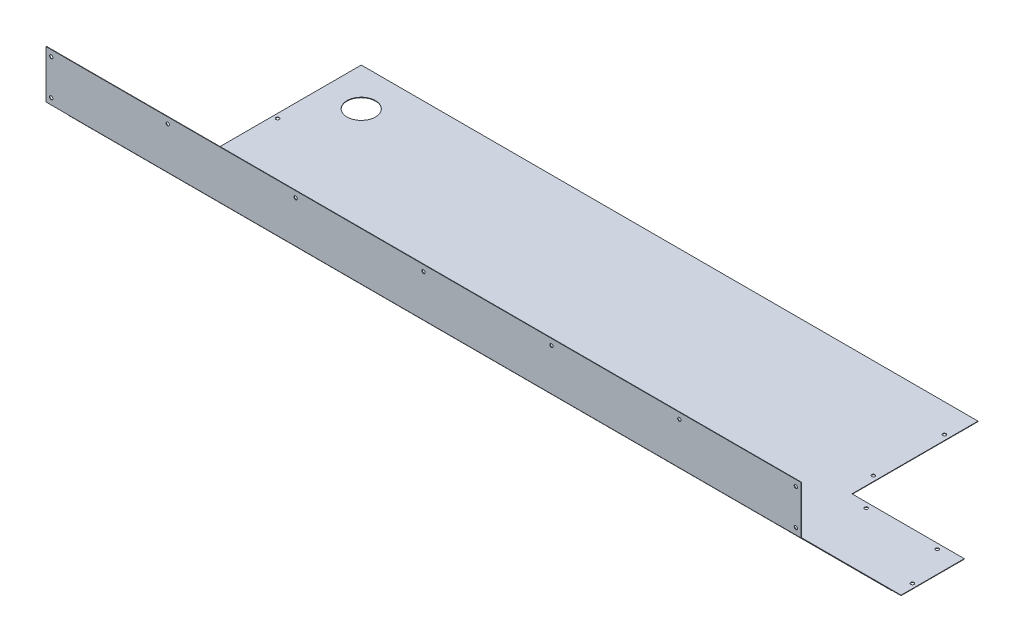
from build123d import *

# Parameters (mm, degrees)
SM_BASE_FLANGE_1_DEPTH = 797
SKETCH_3_W             = 240.030004828
SKETCH_3_H             = 245.89814066
CUT_EXTRUDE_1_DEPTH    = 46
SKETCH_4_W             = 434.416474362
SKETCH_4_H             = 72.764759455
CUT_EXTRUDE_2_DEPTH    = 27.5
SKETCH_6_W             = 323.282059801
SKETCH_6_H             = 316.328682171
CUT_EXTRUDE_3_DEPTH    = 1076.72022385
SKETCH_7_R             = 3.5
CUT_EXTRUDE_4_DEPTH    = 1076.443164468
SKETCH_8_R             = 3.5
CUT_EXTRUDE_5_DEPTH    = 1076.72022385
SKETCH_10_R            = 3.5
CUT_EXTRUDE_6_DEPTH    = 976.892146686
SKETCH_11_R            = 3.5
CUT_EXTRUDE_7_DEPTH    = 977.427672693
SKETCH_12_R            = 30
CUT_EXTRUDE_8_DEPTH    = 1076.72022385


# Sheet-metal steps are written as plain solids
with BuildPart() as part:
    # Sketch 1 → 基体-法兰1 (new, symmetric)
    with BuildSketch(Plane(origin=(0, 0, 0), x_dir=(0, 0, -1), z_dir=(1, 0, 0))):
        with BuildLine():
            Line((0, 340), (0, 238.621320344))
            ThreePointArc((0, 238.621320344), (0.114180701, 238.047295195), (0.439339828, 237.560660172))
            Line((0.439339828, 237.560660172), (237.560660172, 0.439339828))
            ThreePointArc((237.560660172, 0.439339828), (238.047295195, 0.114180701), (238.621320344, 0))
            Line((238.621320344, 0), (638, 0))
            Line((638, 0), (638, 1))
            Line((638, 1), (238.621320344, 1))
            ThreePointArc((238.621320344, 1), (238.429978627, 1.038060234), (238.267766953, 1.146446609))
            Line((238.267766953, 1.146446609), (1.146446609, 238.267766953))
            ThreePointArc((1.146446609, 238.267766953), (1.038060234, 238.429978627), (1, 238.621320344))
            Line((1, 238.621320344), (1, 340))
            Line((1, 340), (0, 340))
        make_face()
    extrude(amount=SM_BASE_FLANGE_1_DEPTH, both=True)

    # 草图3 → 切除-拉伸1 (cut)
    with BuildSketch(Plane(origin=(797, 0, 0), x_dir=(0, 0, -1), z_dir=(1, 0, 0))):
        with Locations((118.60631793, 115.672250014)):
            Rectangle(SKETCH_3_W, SKETCH_3_H)
    cut_extrude_1 = extrude(amount=-CUT_EXTRUDE_1_DEPTH, mode=Mode.SUBTRACT)

    # 草图4 → 切除-拉伸2 (cut)
    with BuildSketch(Plane(origin=(797, 0, 0), x_dir=(0, 0, -1), z_dir=(1, 0, 0))):
        with Locations((445.827818623, 0.227200405)):
            Rectangle(SKETCH_4_W, SKETCH_4_H)
    cut_extrude_2 = extrude(amount=-CUT_EXTRUDE_2_DEPTH, mode=Mode.SUBTRACT)

    # 镜向2: 切除-拉伸1, 切除-拉伸2 across plane
    add(cut_extrude_1.mirror(Plane(origin=(0, 0, 0), x_dir=(0, 0, 1), z_dir=(1, 0, 0))), mode=Mode.SUBTRACT)
    add(cut_extrude_2.mirror(Plane(origin=(0, 0, 0), x_dir=(0, 0, 1), z_dir=(1, 0, 0))), mode=Mode.SUBTRACT)

    # 草图6 → 切除-拉伸3 (cut, through all)
    with BuildSketch(Plane(origin=(0, 1, 0), x_dir=(1, 0, 0), z_dir=(0, 1, 0))):
        with Locations((694.141029901, 530.164341086)):
            Rectangle(SKETCH_6_W, SKETCH_6_H)
    extrude(amount=-CUT_EXTRUDE_3_DEPTH, mode=Mode.SUBTRACT)

    # 草图7 → 切除-拉伸4 (cut, through all)
    with BuildSketch(Plane(origin=(0, 0, -1), x_dir=(-1, 0, 0), z_dir=(0, 0, -1))):
        with Locations(Location((0, 327, 0), (0, 0, 90))):
            Circle(SKETCH_7_R)
        with Locations(Location((270, 327, 0), (0, 0, 90))):
            Circle(SKETCH_7_R)
        with Locations(Location((540, 327, 0), (0, 0, 90))):
            Circle(SKETCH_7_R)
        with Locations(Location((786, 327, 0), (0, 0, 90))):
            Circle(SKETCH_7_R)
        with Locations(Location((786, 252, 0), (0, 0, 90))):
            Circle(SKETCH_7_R)
        with Locations(Location((-270, 327, 0), (0, 0, 90))):
            Circle(SKETCH_7_R)
        with Locations(Location((-540, 327, 0), (0, 0, 90))):
            Circle(SKETCH_7_R)
        with Locations(Location((-786, 327, 0), (0, 0, 90))):
            Circle(SKETCH_7_R)
        with Locations(Location((-786, 252, 0), (0, 0, 90))):
            Circle(SKETCH_7_R)
    extrude(amount=-CUT_EXTRUDE_4_DEPTH, mode=Mode.SUBTRACT)

    # 草图8 → 切除-拉伸5 (cut, through all)
    with BuildSketch(Plane(origin=(0, 1, 0), x_dir=(1, 0, 0), z_dir=(0, 1, 0))):
        with Locations(Location((-760, 452, 0), (0, 0, 270))):
            Circle(SKETCH_8_R)
        with Locations(Location((-760, 272, 0), (0, 0, 270))):
            Circle(SKETCH_8_R)
        with Locations(Location((521.5, 578, 0), (0, 0, 270))):
            Circle(SKETCH_8_R)
        with Locations(Location((521.5, 428, 0), (0, 0, 270))):
            Circle(SKETCH_8_R)
        with Locations(Location((573.5, 361, 0), (0, 0, 270))):
            Circle(SKETCH_8_R)
        with Locations(Location((723.5, 361, 0), (0, 0, 270))):
            Circle(SKETCH_8_R)
        with Locations(Location((760, 272, 0), (0, 0, 270))):
            Circle(SKETCH_8_R)
    extrude(amount=-CUT_EXTRUDE_5_DEPTH, mode=Mode.SUBTRACT)

    # 草图10 → 切除-拉伸6 (cut, through all)
    with BuildSketch(Plane(origin=(0, 119.707106781, -119.707106781), x_dir=(1, 0, 0), z_dir=(0, 0.7071067811865477, -0.7071067811865475))):
        with Locations(Location((740, 2.995728589, 0), (0, 0, 270))):
            Circle(SKETCH_10_R)
        with Locations(Location((740, -142.004271411, 0), (0, 0, 270))):
            Circle(SKETCH_10_R)
        with Locations(Location((740, 147.995728589, 0), (0, 0, 270))):
            Circle(SKETCH_10_R)
    extrude(amount=-CUT_EXTRUDE_6_DEPTH, mode=Mode.SUBTRACT)

    # 草图11 → 切除-拉伸7 (cut, through all)
    with BuildSketch(Plane(origin=(0, 119, -119), x_dir=(1, 0, 0), z_dir=(0, -0.7071067811865477, 0.7071067811865475))):
        with Locations(Location((-740, 142.004271411, 0), (0, 0, 270))):
            Circle(SKETCH_11_R)
        with Locations(Location((-740, -2.995728589, 0), (0, 0, 270))):
            Circle(SKETCH_11_R)
        with Locations(Location((-740, -147.995728589, 0), (0, 0, 270))):
            Circle(SKETCH_11_R)
    extrude(amount=-CUT_EXTRUDE_7_DEPTH, mode=Mode.SUBTRACT)

    # 草图12 → 切除-拉伸8 (cut, through all)
    with BuildSketch(Plane(origin=(0, 1, 0), x_dir=(-1, 0, 0), z_dir=(0, 1, 0))):
        with Locations(Location((689.5, -558, 0), (0, 0, 90))):
            Circle(SKETCH_12_R)
    extrude(amount=-CUT_EXTRUDE_8_DEPTH, mode=Mode.SUBTRACT)


solid = part.part
